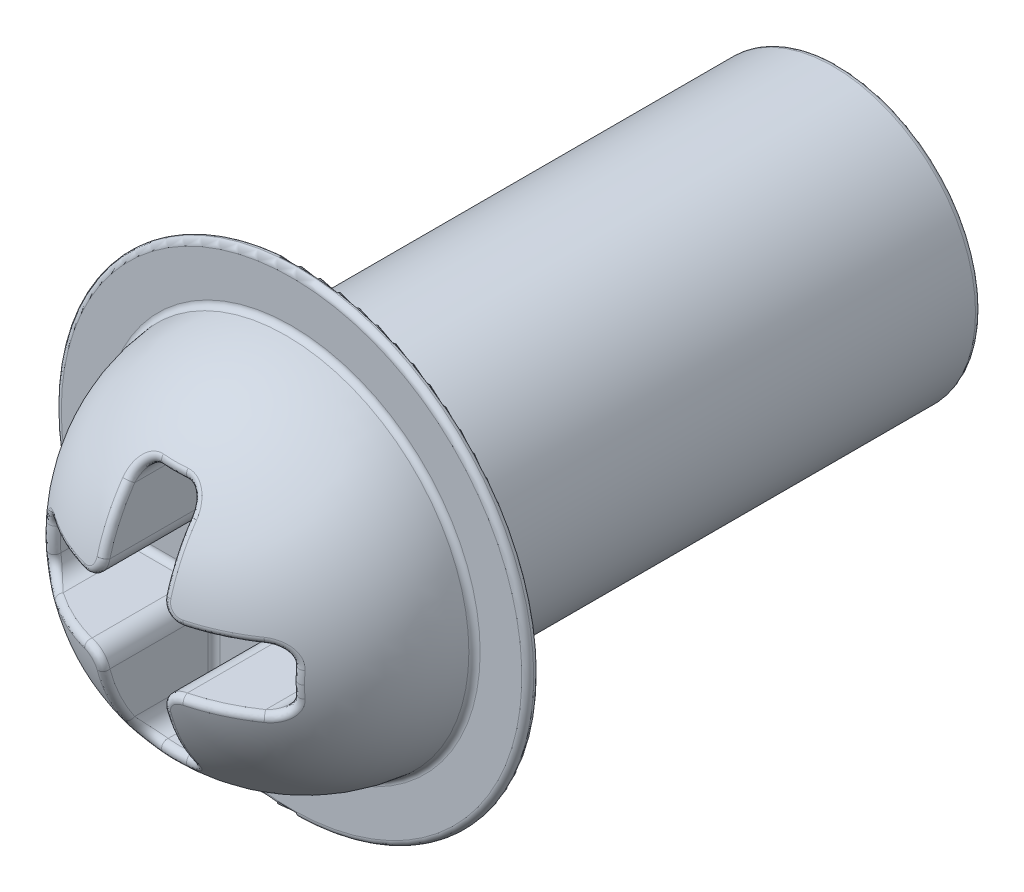
from build123d import *

# Parameters (mm, degrees)
SKETCH1_R           = 2.385
BOSS_EXTRUDE1_DEPTH = 9
SKETCH2_R           = 3.081503537
BOSS_EXTRUDE2_DEPTH = 3
SKETCH3_W           = 1
SKETCH3_H           = 1.5
SKETCH3_H_2         = 1
SKETCH3_W_2         = 1.5
CUT_EXTRUDE1_DEPTH  = 2
FILLET1_R           = 3
FILLET4_R           = 0.3
FILLET5_R           = 0.1
FILLET7_R           = 0.1
FILLET8_R           = 0.1
SKETCH4_R           = 3.966780659
SKETCH4_R_2         = 3.081503537
SKETCH4_R_3         = 2.842274302
BOSS_EXTRUDE4_DEPTH = 0.2
FILLET9_R           = 0.1
FILLET10_R          = 0.1
FILLET11_R          = 0.1


# Some blends are built 0.0001 mm under size
with BuildPart() as part:
    # Sketch1 → Boss-Extrude1 (new body)
    with BuildSketch(Plane.XY):
        Circle(SKETCH1_R)
    extrude(amount=BOSS_EXTRUDE1_DEPTH)

    # Sketch2 → Boss-Extrude2 (add)
    with BuildSketch(Plane.XY.offset(9)):
        Circle(SKETCH2_R)
    extrude(amount=BOSS_EXTRUDE2_DEPTH)

    # Sketch3 → Cut-Extrude1 (cut)
    with BuildSketch(Plane.XY.offset(12)):
        with Locations((0, 1.25)):
            Rectangle(SKETCH3_W, SKETCH3_H)
        Rectangle(SKETCH3_W, SKETCH3_H_2)
        with Locations((0, -1.25)):
            Rectangle(SKETCH3_W, SKETCH3_H)
        with Locations((1.25, 0)):
            Rectangle(SKETCH3_W_2, SKETCH3_H_2)
        with Locations((-1.25, 0)):
            Rectangle(SKETCH3_W_2, SKETCH3_H_2)
    extrude(amount=-CUT_EXTRUDE1_DEPTH, mode=Mode.SUBTRACT)

    # Fillet1
    # the kernel refuses this fillet: 3 mm, written as the material it takes off along each edge
    with BuildSketch(Plane(origin=(0, 0, 12), x_dir=(1, 0, 0), z_dir=(0, -1, 0))) as fillet1_piece_1:
        with BuildLine():
            CenterArc((3.081503537 - FILLET1_R, -FILLET1_R), FILLET1_R, 0, 90)
            Line((3.081503537 - FILLET1_R, 0), (3.081503537, 0))
            Line((3.081503537, 0), (3.081503537, -FILLET1_R))
        make_face()
    revolve(axis=Axis((0, 0, 12), (0, 0, 1)), mode=Mode.SUBTRACT)

    # Fillet4
    fillet4_edges = [part.edges().sort_by_distance(p)[0] for p in [
        (0.5, -2, 10.626876753),
        (-0.5, -2, 10.626876753),
        (2, -0.5, 10.626876753),
        (2, 0.5, 10.626876753),
        (-2, 0.5, 10.626876753),
        (-2, -0.5, 10.626876753),
        (-0.5, -0.5, 10.967022544),
        (0.5, -0.5, 10.967022544),
        (0.5, 0.5, 10.967022544),
        (-0.5, 0.5, 10.967022544),
        (0.5, 2, 10.626876753),
        (-0.5, 2, 10.626876753),
    ]]
    fillet(fillet4_edges, radius=FILLET4_R)

    # Fillet5
    fillet5_edges = [part.edges().sort_by_distance(p)[0] for p in [
        (-0.587867966, -0.587867966, 10),
        (0.587867966, -0.587867966, 10),
        (0.587867966, 0.587867966, 10),
        (-0.587867966, 0.587867966, 10),
        (0.5, -1.25, 10),
        (0, -2, 10),
        (-0.5, 1.25, 10),
        (-1.25, 0.5, 10),
        (-2, 0, 10),
        (-1.25, -0.5, 10),
        (-0.5, -1.25, 10),
        (1.25, -0.5, 10),
        (2, 0, 10),
        (1.25, 0.5, 10),
        (0.5, 1.25, 10),
        (0, 2, 10),
        (-0.412132034, 1.912132034, 10),
        (0.412132034, 1.912132034, 10),
        (-1.912132034, -0.412132034, 10),
        (-1.912132034, 0.412132034, 10),
        (1.912132034, 0.412132034, 10),
        (1.912132034, -0.412132034, 10),
        (-0.412132034, -1.912132034, 10),
        (0.412132034, -1.912132034, 10),
    ]]
    fillet(fillet5_edges, radius=FILLET5_R)

    # Fillet7
    fillet7_edges = [part.edges().sort_by_distance(p)[0] for p in [
        (-2.385, 0, 9),
    ]]
    fillet(fillet7_edges, radius=FILLET7_R)

    # Fillet8
    fillet8_edges = [part.edges().sort_by_distance(p)[0] for p in [
        (-2.385, 0, 0),
    ]]
    fillet(fillet8_edges, radius=FILLET8_R)

    # Sketch4 → Boss-Extrude4 (add)
    # profile 1 of 2: a face of its own
    with BuildSketch(Plane(origin=(0, 0, 9), x_dir=(-1, 0, 0), z_dir=(0, 0, -1))):
        Circle(SKETCH4_R)
        Circle(SKETCH4_R_2, mode=Mode.SUBTRACT)
    # profile 2 of 2: a face of its own
    with BuildSketch(Plane(origin=(0, 0, 9), x_dir=(-1, 0, 0), z_dir=(0, 0, -1))):
        Circle(SKETCH4_R_2)
        Circle(SKETCH4_R_3, mode=Mode.SUBTRACT)
    extrude(amount=-BOSS_EXTRUDE4_DEPTH)

    # Fillet9
    fillet9_edges = [part.edges().sort_by_distance(p)[0] for p in [
        (-3.074829446, -1e-09, 9.2),
    ]]
    fillet(fillet9_edges, radius=FILLET9_R)

    # Fillet10
    fillet10_edges = [part.edges().sort_by_distance(p)[0] for p in [
        (-0.587867966, 0.587867966, 11.904771766),
        (0.587867966, 0.587867966, 11.904771766),
        (0.587867966, -0.587867966, 11.904771766),
        (-0.587867966, -0.587867966, 11.904771766),
        (0.421644296, -1.902172705, 11.348383726),
        (-0.421644295, -1.902172706, 11.348383726),
        (1.902172705, -0.421644295, 11.348383726),
        (1.902172705, 0.421644296, 11.348383726),
        (-1.902172706, 0.421644295, 11.348383726),
        (-1.902172705, -0.421644296, 11.348383726),
        (0.421644296, 1.902172706, 11.348383726),
        (-0.421644296, 1.902172705, 11.348383726),
        (2, 0.100086815, 11.304292043),
        (0.5, -1.2663779, 11.7132232),
        (4e-09, -2, 11.306376231),
        (-0.5, -1.266377903, 11.713223202),
        (2, -0.100086815, 11.304292043),
        (1.266377903, -0.5, 11.713223202),
        (1.2663779, 0.5, 11.7132232),
        (-2, -4e-09, 11.306376231),
        (-1.266377903, 0.5, 11.713223202),
        (-1.2663779, -0.5, 11.7132232),
        (-0.5, 1.2663779, 11.7132232),
        (-4e-09, 2, 11.306376231),
        (0.5, 1.2663779, 11.7132232),
    ]]
    fillet(fillet10_edges, radius=FILLET10_R)

    # Fillet11
    fillet11_edges = [part.edges().sort_by_distance(p)[0] for p in [
        (3.966780659, 0, 9.2),
        (3.966780659, 0, 9),
    ]]
    fillet(fillet11_edges, radius=FILLET11_R - 0.0001)  # a hair under: the kernel refuses the full size


solid = part.part
